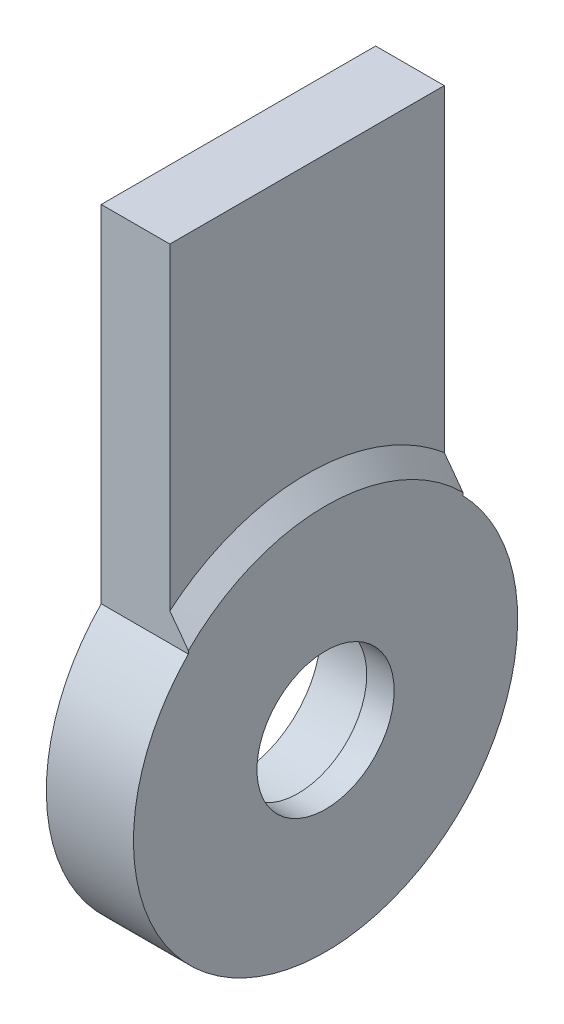
from build123d import *

# Parameters (mm, degrees)
SKETCH1_R           = 5
BOSS_EXTRUDE1_DEPTH = 3.175
SKETCH2_R           = 6
CUT_EXTRUDE1_DEPTH  = 4.35
CUT_EXTRUDE2_DEPTH  = 1.35
CHAMFER2_SIZE       = 1.5
SKETCH8_R           = 12
SKETCH8_R_2         = 7.5
CUT_EXTRUDE3_DEPTH  = 0.75


with BuildPart() as part:
    # Sketch1 → Boss-Extrude1 (new, symmetric)
    with BuildSketch(Plane(origin=(0, 0, 0), x_dir=(0, 0, -1), z_dir=(1, 0, 0))):
        with BuildLine():
            Line((-10, 35), (10, 35))
            Line((10, 35), (10, 9.797958971))
            ThreePointArc((10, 9.797958971), (0, -14), (-10, 9.797958971))
            Line((-10, 9.797958971), (-10, 35))
        make_face()
        Circle(SKETCH1_R, mode=Mode.SUBTRACT)
    extrude(amount=BOSS_EXTRUDE1_DEPTH, both=True)

    # Sketch2 → Cut-Extrude1 (cut)
    with BuildSketch(Plane.ZY.offset(3.175)):
        Circle(SKETCH2_R)
    extrude(amount=-CUT_EXTRUDE1_DEPTH, mode=Mode.SUBTRACT)

    # Sketch4 → Cut-Extrude2 (cut)
    with BuildSketch(Plane.ZY.offset(-3.175)):
        with BuildLine():
            Line((-16.06497938, 41.777700925), (20.751052424, 41.777700925))
            Line((20.751052424, 41.777700925), (18.684504783, 1.284491351))
            Line((18.684504783, 1.284491351), (13.967034386, 0.960182519))
            ThreePointArc((13.967034386, 0.960182519), (0, 14), (-13.967034386, 0.960182519))
            Line((-13.967034386, 0.960182519), (-15.162675902, -1.531420388))
            Line((-15.162675902, -1.531420388), (-19.899722353, 37.471795214))
            Line((-19.899722353, 37.471795214), (-16.06497938, 41.777700925))
        make_face()
    extrude(amount=CUT_EXTRUDE2_DEPTH, mode=Mode.SUBTRACT)

    # Chamfer2
    # the kernel refuses this chamfer: 1.5 mm, written as the material it adds along each edge
    with BuildSketch(Plane(origin=(1.825, 0, 0), x_dir=(0, 0.4790238441764441, 0.8778018892155689), z_dir=(0, -0.8778018892155689, 0.4790238441764441))) as chamfer2_piece_1_section:
        Polygon((14 + CHAMFER2_SIZE, 0), (14, -CHAMFER2_SIZE), (14, 0), align=None)
    chamfer2_piece_1 = revolve(axis=Axis((1.825, 0, 0), (-1, 0, 0)), revolution_arc=122.756665739, mode=Mode.PRIVATE)
    chamfer2_piece_1 = split(chamfer2_piece_1, bisect_by=Plane(origin=(2.457619264, 14.825045671, 10), z_dir=(0, 0, -1)), keep=Keep.TOP, mode=Mode.PRIVATE)
    chamfer2_piece_1 = split(chamfer2_piece_1, bisect_by=Plane(origin=(3.175, 14.825045671, 0), z_dir=(-1, 0, 0)), keep=Keep.TOP, mode=Mode.PRIVATE)
    chamfer2_piece_1 = split(chamfer2_piece_1, bisect_by=Plane(origin=(2.457619264, 14.825045671, -10), z_dir=(0, 0, 1)), keep=Keep.TOP, mode=Mode.PRIVATE)
    add(chamfer2_piece_1)

    # Sketch8 → Cut-Extrude3 (cut)
    with BuildSketch(Plane.ZY.offset(3.175)):
        Circle(SKETCH8_R)
        Circle(SKETCH8_R_2, mode=Mode.SUBTRACT)
    extrude(amount=-CUT_EXTRUDE3_DEPTH, mode=Mode.SUBTRACT)


solid = part.part
